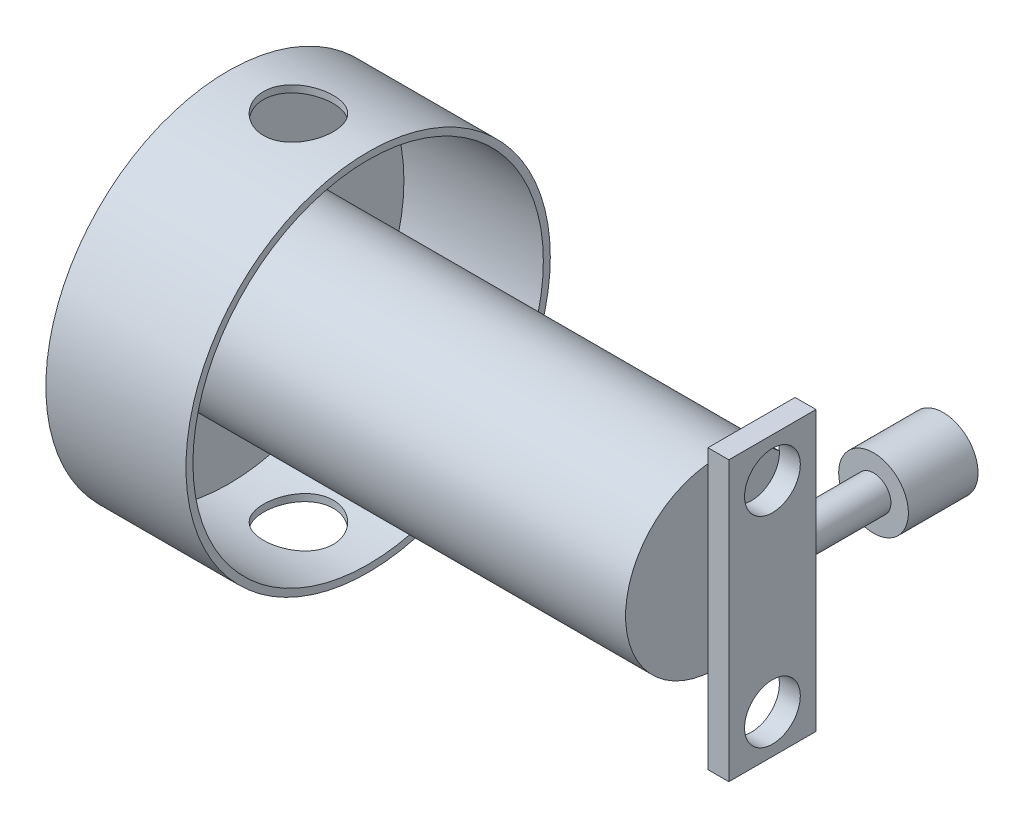
from build123d import *

# Parameters (mm, degrees)
SKETCH1_R               = 26.135
SKETCH1_R_2             = 25.135
EXTRUDE_THIN1_DEPTH     = 20
BOSS_EXTRUDE1_START     = -0.1
SKETCH3_R               = 26.135
BOSS_EXTRUDE1_DEPTH     = 0.1
CUT_EXTRUDE1_DEPTH      = 43.024712373
CUT_EXTRUDE1_DEPTH_BACK = 43.024712373
SKETCH4_R               = 5
SKETCH7_R               = 13.0675
BOSS_EXTRUDE2_DEPTH     = 70
BOSS_EXTRUDE3_START     = -20
BOSS_EXTRUDE3_OUTLINE_R = 2.5
BOSS_EXTRUDE3_DEPTH     = 20
SKETCH8_R               = 5
BOSS_EXTRUDE4_DEPTH     = 10
F_3DSKETCH2_R           = 4
BOSS_EXTRUDE5_DEPTH     = 3


# Read off the part's stored shape, not the designer's step: Boss-Extrude3
with BuildPart() as part:
    # Sketch1 → Extrude-Thin1 (new body)
    with BuildSketch(Plane(origin=(0, 0, 0), x_dir=(0, 0, -1), z_dir=(1, 0, 0))):
        Circle(SKETCH1_R)
        Circle(SKETCH1_R_2, mode=Mode.SUBTRACT)
    extrude(amount=EXTRUDE_THIN1_DEPTH)

    # Sketch3 → Boss-Extrude1 (add)
    with BuildSketch(Plane(origin=(0, 0, 0), x_dir=(0, 0, -1), z_dir=(1, 0, 0)).offset(BOSS_EXTRUDE1_START)):
        Circle(SKETCH3_R)
    extrude(amount=BOSS_EXTRUDE1_DEPTH)

    # Sketch4 → Cut-Extrude1 (cut, two sides: drawn at the far end of the back side and taken through both)
    with BuildSketch(Plane(origin=(0, 0, 0), x_dir=(1, 0, 0), z_dir=(0, 1, 0)).offset(-CUT_EXTRUDE1_DEPTH_BACK)):
        with Locations(Location((10, 0, 0), (0, 0, 270))):
            Circle(SKETCH4_R)
    extrude(amount=CUT_EXTRUDE1_DEPTH + CUT_EXTRUDE1_DEPTH_BACK, mode=Mode.SUBTRACT)

    # Sketch7 → Boss-Extrude2 (add)
    with BuildSketch(Plane(origin=(0, 0, 0), x_dir=(0, 0, -1), z_dir=(1, 0, 0))):
        Circle(SKETCH7_R)
    extrude(amount=BOSS_EXTRUDE2_DEPTH)


with BuildPart() as body_2:
    # Boss-Extrude3 outline → Boss-Extrude3 (new body)
    with BuildSketch(Plane.XY.offset(BOSS_EXTRUDE3_START)):
        with Locations((72.5, 0)):
            Circle(BOSS_EXTRUDE3_OUTLINE_R)
    extrude(amount=BOSS_EXTRUDE3_DEPTH)

    # Sketch8 → Boss-Extrude4 (add)
    with BuildSketch(Plane(origin=(0, 0, -20), x_dir=(-1, 0, 0), z_dir=(0, 0, -1))):
        with Locations((-72.5, 0)):
            Circle(SKETCH8_R)
    extrude(amount=BOSS_EXTRUDE4_DEPTH)


with BuildPart() as body_3:
    # 3DSketch2 → Boss-Extrude5 (new body)
    with BuildSketch(Plane(origin=(75, -20, 6.25), x_dir=(0, 0.9544799780350297, -0.2982749931359468), z_dir=(-1, 0, 0))):
        Polygon((0, 0), (3.728437414, 11.930999725), (41.907636536, 0), (38.179199121, -11.930999725), align=None)
        with Locations(Location((34.602959725, -4.265356706, 0), (0, 0, 72.645975364))):
            Circle(F_3DSKETCH2_R, mode=Mode.SUBTRACT)
        with Locations(Location((7.157563346, 4.311329663, 0), (0, 0, 72.645975364))):
            Circle(F_3DSKETCH2_R, mode=Mode.SUBTRACT)
    extrude(amount=-BOSS_EXTRUDE5_DEPTH)


solid = Compound([part.part, body_2.part, body_3.part])
